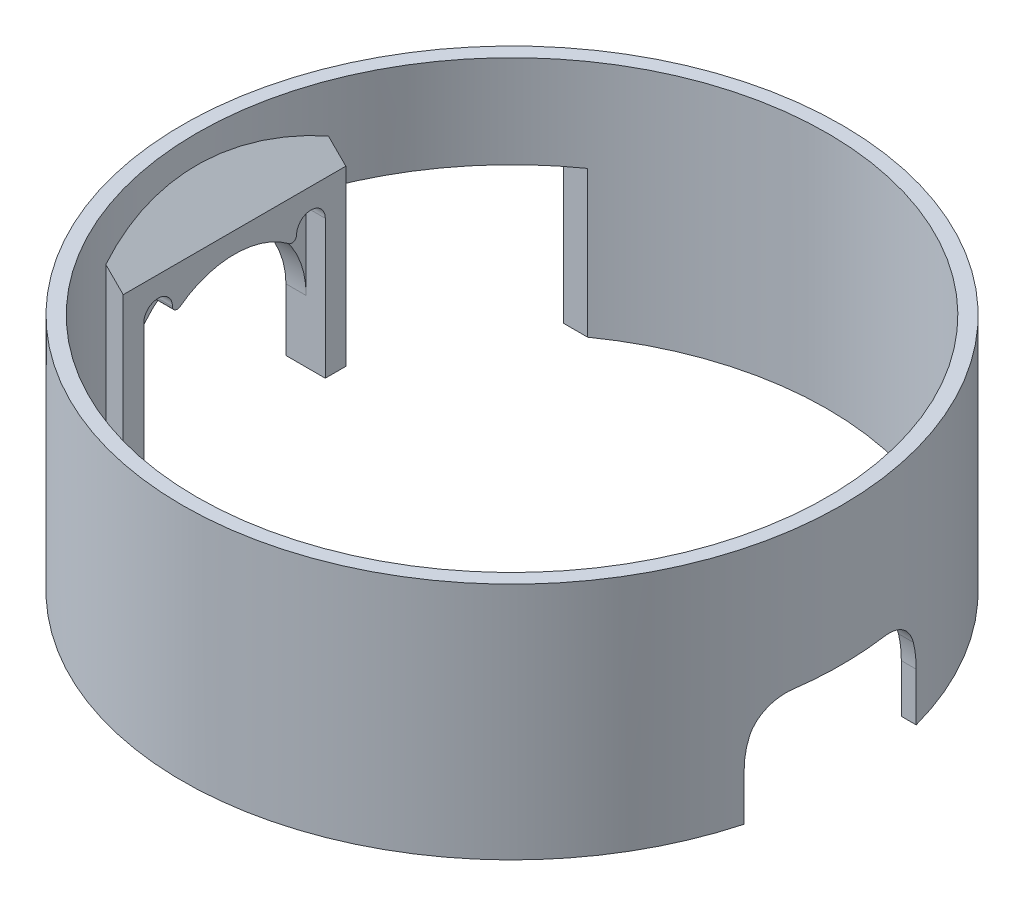
from build123d import *

# Parameters (mm, degrees)
SKETCH1_R           = 69
SKETCH1_R_2         = 66
BOSS_EXTRUDE1_DEPTH = 50
SKETCH4_W           = 30.6
SKETCH4_H           = 30.6
CUT_EXTRUDE2_DEPTH  = 110.644881321
CUT_EXTRUDE6_DEPTH  = 110.644881321
BOSS_EXTRUDE2_REACH = 169.745
BOSS_EXTRUDE2_START = -58.1
SKETCH8_W           = 46.6
SKETCH8_H           = 35
BOSS_EXTRUDE4_DEPTH = 30
SKETCH9_OUTSIDE_W   = 206.079
SKETCH9_OUTSIDE_H   = 183.51
SKETCH9_OUTSIDE_R   = 69
CUT_EXTRUDE7_DEPTH  = 126.083349102
CUT_EXTRUDE8_DEPTH  = 110.644881321
CUT_EXTRUDE9_DEPTH  = 110.644881321
CUT_EXTRUDE11_DEPTH = 4
FILLET3_R           = 1
CUT_EXTRUDE12_DEPTH = 110.644881493


with BuildPart() as part:
    # Sketch1 → Boss-Extrude1 (new body)
    with BuildSketch(Plane(origin=(0, 0, 0), x_dir=(1, 0, 0), z_dir=(0, 1, 0))):
        Circle(SKETCH1_R)
        Circle(SKETCH1_R_2, mode=Mode.SUBTRACT)
    extrude(amount=BOSS_EXTRUDE1_DEPTH)

    # Sketch4 → Cut-Extrude2 (cut, through all)
    with BuildSketch(Plane(origin=(0, 0, 0), x_dir=(0, 0, -1), z_dir=(1, 0, 0))):
        with Locations((38.6, 15.3)):
            Rectangle(SKETCH4_W, SKETCH4_H)
    extrude(amount=-CUT_EXTRUDE2_DEPTH, mode=Mode.SUBTRACT)

    # Sketch5 → Cut-Extrude6 (cut, through all)
    with BuildSketch(Plane(origin=(0, 0, 0), x_dir=(0, 0, -1), z_dir=(1, 0, 0))):
        with BuildLine():
            Line((19, 13), (19, -6))
            Line((19, -6), (-19, -6))
            Line((-19, -6), (-19, 13))
            ThreePointArc((-19, 13), (0, 32), (19, 13))
        make_face()
    extrude(amount=-CUT_EXTRUDE6_DEPTH, mode=Mode.SUBTRACT)

    # Sketch6 → Boss-Extrude2 (add, up to next)
    with BuildSketch(Plane(origin=(0, 0, 0), x_dir=(0, 0, -1), z_dir=(1, 0, 0)).offset(BOSS_EXTRUDE2_START), mode=Mode.PRIVATE) as boss_extrude2_sk1:
        with BuildLine():
            Line((19, 13), (19, 0))
            Line((19, 0), (23.3, 0))
            Line((23.3, 0), (23.3, 13))
            ThreePointArc((23.3, 13), (0, 36.3), (-23.3, 13))
            Line((-23.3, 13), (-23.3, 0))
            Line((-23.3, 0), (-19, 0))
            Line((-19, 0), (-19, 13))
            ThreePointArc((-19, 13), (0, 32), (19, 13))
        make_face()
    boss_extrude2_tool1 = extrude(boss_extrude2_sk1.sketch, amount=-BOSS_EXTRUDE2_REACH, mode=Mode.PRIVATE) - part.part
    add(boss_extrude2_tool1.solids().sort_by_distance((-58.1, 6.5, 22.709301))[0])

    # Sketch8 → Boss-Extrude4 (add)
    with BuildSketch(Plane(origin=(-10.9, -10.9, 0), x_dir=(0, 0, -1), z_dir=(-0.7071067811865512, -0.7071067811865438, 0))):
        with Locations((0, -66.582903987)):
            Rectangle(SKETCH8_W, SKETCH8_H)
    extrude(amount=BOSS_EXTRUDE4_DEPTH)

    # Sketch9 outside → Cut-Extrude7 (cut, through all)
    with BuildSketch(Plane.XZ):
        with Locations((-11.2845, 0)):
            Rectangle(SKETCH9_OUTSIDE_W, SKETCH9_OUTSIDE_H)
        Circle(SKETCH9_OUTSIDE_R, mode=Mode.SUBTRACT)
    extrude(amount=-CUT_EXTRUDE7_DEPTH, mode=Mode.SUBTRACT)

    # Sketch9<3> → Cut-Extrude8 (cut, through all)
    with BuildSketch(Plane.XZ):
        with BuildLine():
            Line((-58.1, -19), (-58.1, -23.3))
            Line((-58.1, -23.3), (-61.750384614, -23.3))
            ThreePointArc((-61.750384614, -23.3), (-52.211852364, -40.372298334), (-38.089237325, -53.9))
            ThreePointArc((-38.089237325, -53.9), (63.102674486, 19.340436209), (-61.750384614, 23.3))
            Line((-61.750384614, 23.3), (-58.1, 23.3))
            Line((-58.1, 23.3), (-58.1, 19))
            Line((-58.1, 19), (-58.1, -19))
        make_face()
    extrude(amount=-CUT_EXTRUDE8_DEPTH, mode=Mode.SUBTRACT)

    # Sketch5<2> → Cut-Extrude9 (cut, through all)
    with BuildSketch(Plane(origin=(0, 0, 0), x_dir=(0, 0, -1), z_dir=(1, 0, 0))):
        with BuildLine():
            Line((19, 13), (19, -6))
            Line((19, -6), (-19, -6))
            Line((-19, -6), (-19, 13))
            ThreePointArc((-19, 13), (0, 32), (19, 13))
        make_face()
    extrude(amount=-CUT_EXTRUDE9_DEPTH, mode=Mode.SUBTRACT)

    # Sketch11 → Cut-Extrude11 (cut)
    with BuildSketch(Plane(origin=(-58.1, 0, 0), x_dir=(0, 0, -1), z_dir=(1, 0, 0))):
        with BuildLine():
            Line((-19.000000298, 29.000000238), (-19, 11.000000238))
            Line((-19, 11.000000238), (-13.000000298, 11.000000238))
            Line((-13.000000298, 11.000000238), (-13.000000298, 29.000000238))
            ThreePointArc((-13.000000298, 29.000000238), (-16.000000298, 32.000000238), (-19.000000298, 29.000000238))
        make_face()
        with BuildLine():
            Line((12.999999702, 29.000000238), (12.999999702, 11.000000238))
            Line((12.999999702, 11.000000238), (19, 11.000000238))
            Line((19, 11.000000238), (18.999999702, 29.000000238))
            ThreePointArc((18.999999702, 29.000000238), (15.999999702, 32.000000238), (12.999999702, 29.000000238))
        make_face()
    extrude(amount=-CUT_EXTRUDE11_DEPTH, mode=Mode.SUBTRACT)

    # Fillet3
    fillet3_edges = [part.edges().sort_by_distance(p)[0] for p in [
        (-60.1, 26.85640674, -12.999999702),
        (-60.1, 26.856406181, 13.000000298),
    ]]
    fillet(fillet3_edges, radius=FILLET3_R)

    # Sketch12 → Cut-Extrude12 (cut, through all)
    with BuildSketch(Plane(origin=(0, 0, 0), x_dir=(0, 0, -1), z_dir=(1, 0, 0))):
        with BuildLine():
            Line((-18, -0.9), (18, -0.9))
            Line((18, -0.9), (18.000000023, 10.1))
            ThreePointArc((18.000000023, 10.1), (17.791519182, 12.83163922), (17.170905636, 15.500001247))
            ThreePointArc((17.170905636, 15.500001247), (14.272255847, 19.549807452), (9.539392014, 21.100001244))
            Line((9.539392014, 21.100001244), (-9.539392014, 21.100001244))
            ThreePointArc((-9.539392014, 21.100001244), (-14.272255841, 19.549807443), (-17.170905626, 15.500001244))
            ThreePointArc((-17.170905626, 15.500001244), (-17.791519159, 12.831639216), (-18, 10.1))
            Line((-18, 10.1), (-18, -0.9))
        make_face()
    extrude(amount=CUT_EXTRUDE12_DEPTH, mode=Mode.SUBTRACT)


solid = part.part
